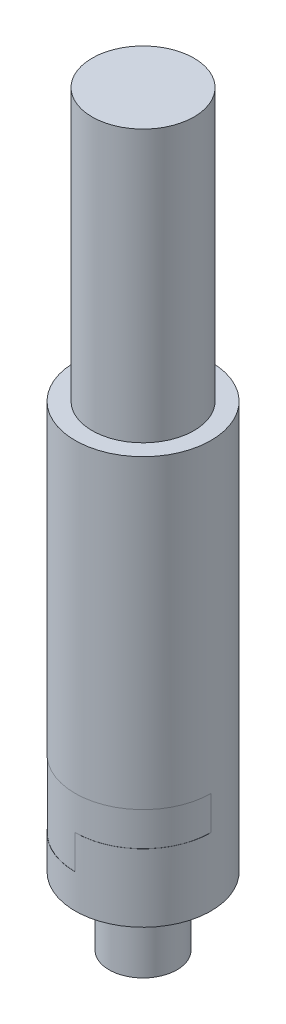
from build123d import *

# Parameters (mm, degrees)
SKETCH1_R           = 9.525
BOSS_EXTRUDE1_DEPTH = 50.8
SKETCH2_R           = 12.7
BOSS_EXTRUDE2_DEPTH = 76.2
SKETCH3_R           = 6.35
BOSS_EXTRUDE3_DEPTH = 12.7
CUT_EXTRUDE1_START  = -6.35
CUT_EXTRUDE1_DEPTH  = 6.35
CUT_EXTRUDE2_START  = -6.35
CUT_EXTRUDE2_DEPTH  = 6.35


with BuildPart() as part:
    # Sketch1 → Boss-Extrude1 (new body)
    with BuildSketch(Plane(origin=(0, 0, 0), x_dir=(1, 0, 0), z_dir=(0, 1, 0))):
        Circle(SKETCH1_R)
    extrude(amount=BOSS_EXTRUDE1_DEPTH)

    # Sketch2 → Boss-Extrude2 (add)
    with BuildSketch(Plane.XZ):
        Circle(SKETCH2_R)
    extrude(amount=BOSS_EXTRUDE2_DEPTH)

    # Sketch3 → Boss-Extrude3 (add)
    with BuildSketch(Plane.XZ.offset(76.2)):
        Circle(SKETCH3_R)
    extrude(amount=BOSS_EXTRUDE3_DEPTH)

    # Sketch4 → Cut-Extrude1 (cut)
    with BuildSketch(Plane(origin=(0, -69.85, 0), x_dir=(-1, 0, 0), z_dir=(0, -1, 0)).offset(CUT_EXTRUDE1_START)):
        with BuildLine():
            Line((0, 12.7), (0, 12.6746))
            ThreePointArc((0, 12.6746), (12.6746, 0), (0, -12.6746))
            Line((0, -12.6746), (0, -12.7))
            ThreePointArc((0, -12.7), (12.7, 0), (0, 12.7))
        make_face()
    extrude(amount=CUT_EXTRUDE1_DEPTH, mode=Mode.SUBTRACT)

    # Sketch5 → Cut-Extrude2 (cut)
    with BuildSketch(Plane.XZ.offset(63.5).offset(CUT_EXTRUDE2_START)):
        with BuildLine():
            Line((-12.7, 0), (-12.6746, 0))
            ThreePointArc((-12.6746, 0), (0, 12.6746), (12.6746, 0))
            Line((12.6746, 0), (12.7, 0))
            ThreePointArc((12.7, 0), (0, 12.7), (-12.7, 0))
        make_face()
    extrude(amount=CUT_EXTRUDE2_DEPTH, mode=Mode.SUBTRACT)


solid = part.part
